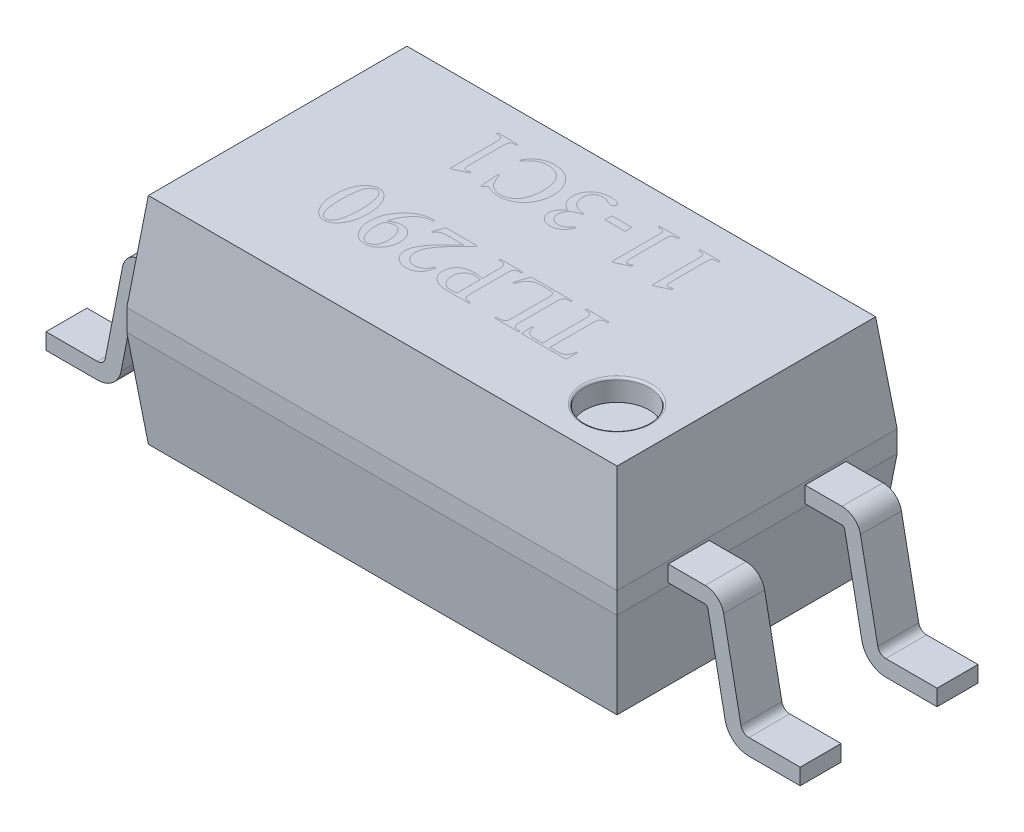
from build123d import *
from OCP.BRepFilletAPI import BRepFilletAPI_MakeChamfer

# Parameters (mm, degrees)
EXTRUDE_1_DEPTH          = 1
EXTRUDE_1_DEPTH_BACK     = 1
SKETCH_1_W               = 4.55
SKETCH_1_H               = 2.6
CHAMFER_1_SIZE           = 0.9
CHAMFER_1_SIZE2          = 0.1
CHAMFER_2_SIZE           = 0.1
CHAMFER_2_SIZE2          = 0.9
SKETCH_3_W               = 0.38
SKETCH_3_H               = 0.15
PATTERN_LINEAR_1_COUNT   = 2
PATTERN_LINEAR_1_PITCH   = 1.27
MIRROR_2_COPY_1_SKETCH_W = 0.38
MIRROR_2_COPY_1_SKETCH_H = 0.15
MIRROR_2_COPY_2_SKETCH_W = 0.38
MIRROR_2_COPY_2_SKETCH_H = 0.15
SKETCH_4_R               = 0.3
CUT_EXTRUDE_2_DEPTH      = 0.2
FILLET_1_R               = 0.02


with BuildPart() as part:
    # Эскиз1 → Вытянуть1 (new, two sides: drawn at the far end of the back side and taken through both)
    with BuildSketch(Plane(origin=(0, 0, 0), x_dir=(1, 0, 0), z_dir=(0, 1, 0)).offset(-EXTRUDE_1_DEPTH_BACK)):
        Rectangle(SKETCH_1_W, SKETCH_1_H)
    extrude(amount=EXTRUDE_1_DEPTH + EXTRUDE_1_DEPTH_BACK)

    # Фаска1: one chamfer whose edges measure the first distance from different faces: ONE call of the kernel's chamfer builder (chamfer() names one face for all edges)
    chamfer_1_edges_1 = [part.edges().sort_by_distance(p)[0] for p in [
        (0, 1, -1.3),
    ]]
    chamfer_1_side_1 = [part.faces().sort_by_distance(p)[0] for p in [
        (0, 0, -1.3),
    ]]
    chamfer_1_edges_2 = [part.edges().sort_by_distance(p)[0] for p in [
        (2.275, 1, 0),
    ]]
    chamfer_1_side_2 = [part.faces().sort_by_distance(p)[0] for p in [
        (2.275, 0, 0),
    ]]
    chamfer_1_edges_3 = [part.edges().sort_by_distance(p)[0] for p in [
        (0, 1, 1.3),
    ]]
    chamfer_1_side_3 = [part.faces().sort_by_distance(p)[0] for p in [
        (0, 0, 1.3),
    ]]
    chamfer_1_edges_4 = [part.edges().sort_by_distance(p)[0] for p in [
        (-2.275, 1, 0),
    ]]
    chamfer_1_side_4 = [part.faces().sort_by_distance(p)[0] for p in [
        (-2.275, 0, 0),
    ]]
    chamfer_1 = BRepFilletAPI_MakeChamfer(part.part.solid().wrapped)
    for e in chamfer_1_edges_1:
        chamfer_1.Add(CHAMFER_1_SIZE, CHAMFER_1_SIZE2, e.wrapped, chamfer_1_side_1[0].wrapped)  # the first distance lies on this face
    for e in chamfer_1_edges_2:
        chamfer_1.Add(CHAMFER_1_SIZE, CHAMFER_1_SIZE2, e.wrapped, chamfer_1_side_2[0].wrapped)  # the first distance lies on this face
    for e in chamfer_1_edges_3:
        chamfer_1.Add(CHAMFER_1_SIZE, CHAMFER_1_SIZE2, e.wrapped, chamfer_1_side_3[0].wrapped)  # the first distance lies on this face
    for e in chamfer_1_edges_4:
        chamfer_1.Add(CHAMFER_1_SIZE, CHAMFER_1_SIZE2, e.wrapped, chamfer_1_side_4[0].wrapped)  # the first distance lies on this face
    add(Compound.cast(chamfer_1.Shape()), mode=Mode.REPLACE)

    # Фаска2
    chamfer_2_edges = [part.edges().sort_by_distance(p)[0] for p in [
        (0, -1, 1.3),
        (2.275, -1, 0),
        (0, -1, -1.3),
        (-2.275, -1, 0),
    ]]
    chamfer_2_side = [part.faces().sort_by_distance(p)[0] for p in [
        (0, -1, 0),
    ]]
    chamfer(chamfer_2_edges, length=CHAMFER_2_SIZE, length2=CHAMFER_2_SIZE2, reference=chamfer_2_side[0])

    # По траектории2: sweep along a path in Эскиз2
    with BuildLine(Plane.XY.offset(0.635)) as sweep_2_path:
        Line((2.275, 0), (2.617703636, 0))
        ThreePointArc((2.617703636, 0), (2.681248326, -0.022785543), (2.715835011, -0.080758554))
        Line((2.715835011, -0.080758554), (2.876247484, -0.898862169))
        ThreePointArc((2.876247484, -0.898862169), (2.928127511, -0.985821685), (3.023444547, -1.02))
        Line((3.023444547, -1.02), (3.5, -1.02))
    # Эскиз3 → По траектории2 (sweep)
    with BuildSketch(Plane(origin=(3.5, -1.02, 0.635), x_dir=(0, 0, 1), z_dir=(-1, 0, 0))):
        Rectangle(SKETCH_3_W, SKETCH_3_H)
    sweep_2 = sweep(path=sweep_2_path.line)

    # Линейный массив1: По траектории2 ×2
    with Locations(*[(0, 0, -i * PATTERN_LINEAR_1_PITCH) for i in range(1, PATTERN_LINEAR_1_COUNT)]):
        add(sweep_2)

    # Зеркальное отражение2 copy 1: sweep along a path in Зеркальное отражение2 copy 1 path
    with BuildLine(Plane(origin=(0, 0, -0.635), x_dir=(-1, 0, 0), z_dir=(0, 0, 1))) as mirror_2_copy_1_path:
        Line((2.275, 0), (2.617703636, 0))
        ThreePointArc((2.617703636, 0), (2.681248326, 0.022785543), (2.715835011, 0.080758554))
        Line((2.715835011, 0.080758554), (2.876247484, 0.898862169))
        ThreePointArc((2.876247484, 0.898862169), (2.928127511, 0.985821685), (3.023444547, 1.02))
        Line((3.023444547, 1.02), (3.5, 1.02))
    # Зеркальное отражение2 copy 1 sketch → Зеркальное отражение2 copy 1 (sweep)
    with BuildSketch(Plane(origin=(-3.5, -1.02, -0.635), x_dir=(0, 0, 1), z_dir=(1, 0, 0))):
        Rectangle(MIRROR_2_COPY_1_SKETCH_W, MIRROR_2_COPY_1_SKETCH_H)
    sweep(path=mirror_2_copy_1_path.line)

    # Зеркальное отражение2 copy 2: sweep along a path in Зеркальное отражение2 copy 2 path
    with BuildLine(Plane(origin=(0, 0, 0.635), x_dir=(-1, 0, 0), z_dir=(0, 0, 1))) as mirror_2_copy_2_path:
        Line((2.275, 0), (2.617703636, 0))
        ThreePointArc((2.617703636, 0), (2.681248326, 0.022785543), (2.715835011, 0.080758554))
        Line((2.715835011, 0.080758554), (2.876247484, 0.898862169))
        ThreePointArc((2.876247484, 0.898862169), (2.928127511, 0.985821685), (3.023444547, 1.02))
        Line((3.023444547, 1.02), (3.5, 1.02))
    # Зеркальное отражение2 copy 2 sketch → Зеркальное отражение2 copy 2 (sweep)
    with BuildSketch(Plane(origin=(-3.5, -1.02, 0.635), x_dir=(0, 0, 1), z_dir=(1, 0, 0))):
        Rectangle(MIRROR_2_COPY_2_SKETCH_W, MIRROR_2_COPY_2_SKETCH_H)
    sweep(path=mirror_2_copy_2_path.line)

    # Эскиз4 → Вытянуть2 (cut)
    with BuildSketch(Plane(origin=(0, 1, 0), x_dir=(1, 0, 0), z_dir=(0, 1, 0))):
        with Locations((1.675, -0.7)):
            Circle(SKETCH_4_R)
    extrude(amount=-CUT_EXTRUDE_2_DEPTH, mode=Mode.SUBTRACT)

    # Скругление1
    fillet_1_edges = [part.edges().sort_by_distance(p)[0] for p in [
        (1.375, 1, 0.7),
    ]]
    fillet(fillet_1_edges, radius=FILLET_1_R)


solid = part.part
